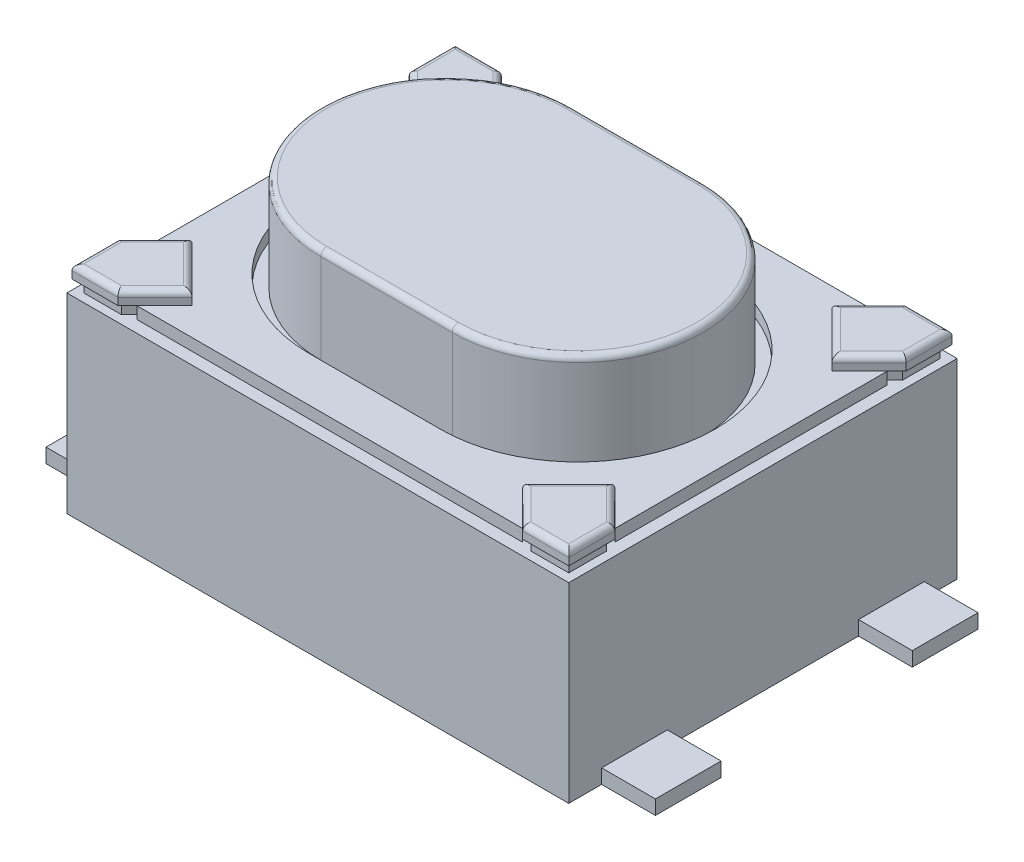
from build123d import *

# Parameters (mm, degrees)
SKETCH1_W            = 4.2
SKETCH1_H            = 3.25
BOSS_EXTRUDE1_DEPTH  = 1.6
SKETCH2_W            = 4
SKETCH2_H            = 3.05
BOSS_EXTRUDE2_DEPTH  = 0.1
BOSS_EXTRUDE3_DEPTH  = 0.8
SKETCH4_W            = 5.1
SKETCH4_H            = 0.55
LEAD_DEPTH           = 0.12
FILLET1_R            = 0.05
CUT_EXTRUDE1_DEPTH   = 0.1
MIRROR4_COPY_1_DEPTH = 0.1
BOSS_EXTRUDE5_DEPTH  = 0.101
BOSS_EXTRUDE6_DEPTH  = 0.11
FILLET3_R            = 0.05
FILLET3_OF_MIRROR6_R = 0.05


# Read off the part's stored shape, not the designer's step: Mirror7
with BuildPart() as part:
    # Sketch1 → Boss-Extrude1 (new body)
    with BuildSketch(Plane(origin=(0, 0, 0), x_dir=(1, 0, 0), z_dir=(0, 1, 0))):
        Rectangle(SKETCH1_W, SKETCH1_H)
    extrude(amount=BOSS_EXTRUDE1_DEPTH)

    # Sketch2 → Boss-Extrude2 (add)
    with BuildSketch(Plane(origin=(0, 1.6, 0), x_dir=(1, 0, 0), z_dir=(0, 1, 0))):
        Rectangle(SKETCH2_W, SKETCH2_H)
        with BuildLine():
            Line((-0.55, 1.15), (0.55, 1.15))
            ThreePointArc((0.55, 1.15), (1.7, 0), (0.55, -1.15))
            Line((0.55, -1.15), (-0.55, -1.15))
            ThreePointArc((-0.55, -1.15), (-1.7, 0), (-0.55, 1.15))
        make_face(mode=Mode.SUBTRACT)
    extrude(amount=BOSS_EXTRUDE2_DEPTH)

    # Sketch3 → Boss-Extrude3 (add)
    with BuildSketch(Plane(origin=(0, 1.6, 0), x_dir=(1, 0, 0), z_dir=(0, 1, 0))):
        with BuildLine():
            Line((-0.55, -1.05), (0.55, -1.05))
            ThreePointArc((0.55, -1.05), (1.6, 0), (0.55, 1.05))
            Line((0.55, 1.05), (-0.55, 1.05))
            ThreePointArc((-0.55, 1.05), (-1.6, 0), (-0.55, -1.05))
        make_face()
    extrude(amount=BOSS_EXTRUDE3_DEPTH)

    # Sketch4 → lead (add)
    with BuildSketch(Plane.XZ):
        with Locations((0, 1.075)):
            Rectangle(SKETCH4_W, SKETCH4_H)
    lead = extrude(amount=-LEAD_DEPTH)

    # Mirror1: lead across plane
    add(lead.mirror(Plane.XY))

    # Fillet1
    fillet1_edges = [part.edges().sort_by_distance(p)[0] for p in [
        (-1.6, 2.4, 0),
        (0, 2.4, 1.05),
        (1.6, 2.4, 0),
        (0, 2.4, -1.05),
    ]]
    fillet(fillet1_edges, radius=FILLET1_R)

    # Sketch5 → Cut-Extrude1 (cut)
    with BuildSketch(Plane(origin=(0, 1.7, 0), x_dir=(1, 0, 0), z_dir=(0, 1, 0))):
        Polygon((-2, 1.525), (-2, 1.139738664), (-1.768366599, 0.908105264), (-1.383105264, 1.293366599), (-1.614738664, 1.525), align=None)
    cut_extrude1 = extrude(amount=-CUT_EXTRUDE1_DEPTH, mode=Mode.SUBTRACT)

    # Mirror3: Cut-Extrude1 across plane
    add(cut_extrude1.mirror(Plane(origin=(0, 0, 0), x_dir=(0, 0, 1), z_dir=(1, 0, 0))), mode=Mode.SUBTRACT)

    # Mirror4: Cut-Extrude1 across plane
    add(cut_extrude1.mirror(Plane.XY), mode=Mode.SUBTRACT)

    # Mirror4 copy 1 sketch → Mirror4 copy 1 (cut)
    with BuildSketch(Plane(origin=(0, 1.7, 0), x_dir=(-1, 0, 0), z_dir=(0, 1, 0))):
        Polygon((-2, 1.525), (-2, 1.139738664), (-1.768366599, 0.908105264), (-1.383105264, 1.293366599), (-1.614738664, 1.525), align=None)
    extrude(amount=-MIRROR4_COPY_1_DEPTH, mode=Mode.SUBTRACT)

    # Sketch6 → Boss-Extrude5 (add)
    with BuildSketch(Plane(origin=(0, 1.6, 0), x_dir=(1, 0, 0), z_dir=(0, 1, 0))):
        Polygon((-1.650094004, 1.489644661), (-1.714738664, 1.554289322), (-2.029289322, 1.554289322), (-2.029289322, 1.239738664), (-1.964644661, 1.175094004), (-1.768366599, 0.978815942), (-1.453815942, 1.293366599), align=None)
    boss_extrude5 = extrude(amount=BOSS_EXTRUDE5_DEPTH)

    # Sketch7 → Boss-Extrude6 (add)
    with BuildSketch(Plane(origin=(0, 1.701, 0), x_dir=(1, 0, 0), z_dir=(0, 1, 0))):
        Polygon((-1.694027986, 1.604289322), (-2.079289322, 1.604289322), (-2.079289322, 1.219027986), (-1.768366599, 0.908105264), (-1.383105264, 1.293366599), align=None)
    boss_extrude6 = extrude(amount=BOSS_EXTRUDE6_DEPTH)

    # Fillet3
    fillet3_edges = [part.edges().sort_by_distance(p)[0] for p in [
        (-1.538566625, 1.811, -1.44882796),
        (-1.886658654, 1.811, -1.604289322),
        (-2.079289322, 1.811, -1.411658654),
        (-1.92382796, 1.811, -1.063566625),
        (-1.575735931, 1.811, -1.100735931),
    ]]
    fillet(fillet3_edges, radius=FILLET3_R)

    # Mirror6: Boss-Extrude5, Boss-Extrude6 across plane
    add(boss_extrude5.mirror(Plane(origin=(0, 0, 0), x_dir=(0, 0, 1), z_dir=(1, 0, 0))))
    add(boss_extrude6.mirror(Plane(origin=(0, 0, 0), x_dir=(0, 0, 1), z_dir=(1, 0, 0))))

    # Fillet3 of Mirror6
    fillet3_of_mirror6_edges = [part.edges().sort_by_distance(p)[0] for p in [
        (1.538566625, 1.811, -1.44882796),
        (1.886658654, 1.811, -1.604289322),
        (2.079289322, 1.811, -1.411658654),
        (1.92382796, 1.811, -1.063566625),
        (1.575735931, 1.811, -1.100735931),
    ]]
    fillet(fillet3_of_mirror6_edges, radius=FILLET3_OF_MIRROR6_R)

    # Mirror7: part across plane


with BuildPart() as part_1:
    add(part.part)
    add(part.part.mirror(Plane.XY))


solid = part_1.part
